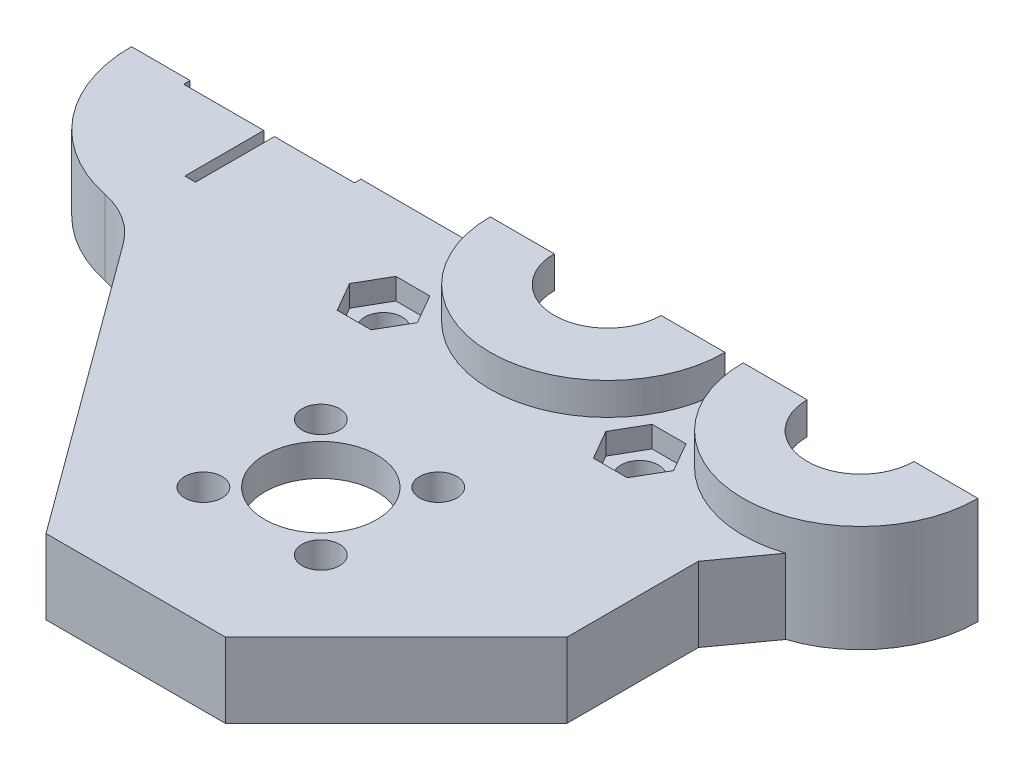
from build123d import *

# Parameters (mm, degrees)
SKETCH3_R               = 8
SKETCH3_W               = 54.803
SKETCH3_H               = 30
SKETCH3_R_2             = 5.25
BOSS_EXTRUDE1_DEPTH     = 7
CUT_EXTRUDE3_DEPTH      = 63.702230973
CUT_EXTRUDE3_DEPTH_BACK = 63.702230973
SKETCH4_R               = 1.75
CHAMFER1_SIZE           = 2.5
CUT_EXTRUDE5_DEPTH      = 63.702230973
CUT_EXTRUDE5_DEPTH_BACK = 63.702230973
SKETCH9_R               = 1.75
CUT_EXTRUDE6_START      = -2
SKETCH10_R              = 1.75
CUT_EXTRUDE6_DEPTH      = 2
CHAMFER3_SIZE2          = 22
CHAMFER3_SIZE           = 30
CHAMFER4_SIZE           = 16
FILLET1_DEPTH           = 7
BOSS_EXTRUDE6_START     = -5
SKETCH15_R              = 10.5
BOSS_EXTRUDE6_DEPTH     = 5
CUT_EXTRUDE7_DEPTH      = 63.702230973
CUT_EXTRUDE7_DEPTH_BACK = 63.702230973
SKETCH16_W              = 93.911326915
SKETCH16_H              = 20.32689663
SKETCH17_R              = 11.5
SKETCH17_R_2            = 5.25
CUT_EXTRUDE8_DEPTH      = 4
BOSS_EXTRUDE7_DEPTH     = 3


with BuildPart() as part:
    # Sketch3 → Boss-Extrude1 (new body)
    # profile 1 of 10: a face of its own
    with BuildSketch(Plane(origin=(0, 0, 0), x_dir=(1, 0, 0), z_dir=(0, 1, 0))):
        with BuildLine():
            ThreePointArc((-17.613, 0), (-21.567058454, 9.545941546), (-31.113, 13.5))
            Line((-31.113, 13.5), (-31.113, 10.5))
            ThreePointArc((-31.113, 10.5), (-23.688378798, 7.424621202), (-20.613, 0))
            ThreePointArc((-20.613, 0), (-23.688378798, -7.424621202), (-31.113, -10.5))
            Line((-31.113, -10.5), (-31.113, -13.5))
            ThreePointArc((-31.113, -13.5), (-21.567058454, -9.545941546), (-17.613, 0))
        make_face()
    # profile 2 of 10: a face of its own
    with BuildSketch(Plane(origin=(0, 0, 0), x_dir=(1, 0, 0), z_dir=(0, 1, 0))):
        with BuildLine():
            Line((-31.113, 10.5), (-31.113, 13.5))
            ThreePointArc((-31.113, 13.5), (-44.613, 0), (-31.113, -13.5))
            Line((-31.113, -13.5), (-31.113, -10.5))
            ThreePointArc((-31.113, -10.5), (-41.613, 0), (-31.113, 10.5))
        make_face()
    # profile 3 of 10: a face of its own
    with BuildSketch(Plane(origin=(0, 0, 0), x_dir=(1, 0, 0), z_dir=(0, 1, 0))):
        with BuildLine():
            Line((23.69, 13.5), (-31.113, 13.5))
            ThreePointArc((-31.113, 13.5), (-21.567058454, 9.545941546), (-17.613, 0))
            ThreePointArc((-17.613, 0), (-21.567058454, -9.545941546), (-31.113, -13.5))
            Line((-31.113, -13.5), (23.69, -13.5))
            Line((23.69, -13.5), (23.69, -11))
            ThreePointArc((23.69, -11), (12.69, 0), (23.69, 11))
            Line((23.69, 11), (23.69, 13.5))
        make_face()
        with Locations(Location((0, 0, 0), (0, 0, 270))):
            Circle(SKETCH3_R, mode=Mode.SUBTRACT)
    # profile 4 of 10: a face of its own
    with BuildSketch(Plane(origin=(0, 0, 0), x_dir=(1, 0, 0), z_dir=(0, 1, 0))):
        with BuildLine():
            ThreePointArc((-17.613, 0), (-21.567058454, 9.545941546), (-31.113, 13.5))
            Line((-31.113, 13.5), (-31.113, 10.5))
            ThreePointArc((-31.113, 10.5), (-23.688378798, 7.424621202), (-20.613, 0))
            ThreePointArc((-20.613, 0), (-23.688378798, -7.424621202), (-31.113, -10.5))
            Line((-31.113, -10.5), (-31.113, -13.5))
            ThreePointArc((-31.113, -13.5), (-21.567058454, -9.545941546), (-17.613, 0))
        make_face()
    # profile 5 of 10: a face of its own
    with BuildSketch(Plane(origin=(0, 0, 0), x_dir=(1, 0, 0), z_dir=(0, 1, 0))):
        with BuildLine():
            Line((-31.113, 10.5), (-31.113, 13.5))
            ThreePointArc((-31.113, 13.5), (-44.613, 0), (-31.113, -13.5))
            Line((-31.113, -13.5), (-31.113, -10.5))
            ThreePointArc((-31.113, -10.5), (-41.613, 0), (-31.113, 10.5))
        make_face()
    # profile 6 of 10: a face of its own
    with BuildSketch(Plane(origin=(0, 0, 0), x_dir=(1, 0, 0), z_dir=(0, 1, 0))):
        with BuildLine():
            ThreePointArc((34.69, 0), (31.468174593, 7.778174593), (23.69, 11))
            Line((23.69, 11), (23.69, 8))
            ThreePointArc((23.69, 8), (29.346854249, 5.656854249), (31.69, 0))
            ThreePointArc((31.69, 0), (29.346854249, -5.656854249), (23.69, -8))
            Line((23.69, -8), (23.69, -11))
            ThreePointArc((23.69, -11), (31.468174593, -7.778174593), (34.69, 0))
        make_face()
    # profile 7 of 10: a face of its own
    with BuildSketch(Plane(origin=(0, 0, 0), x_dir=(1, 0, 0), z_dir=(0, 1, 0))):
        with BuildLine():
            Line((23.69, 8), (23.69, 11))
            ThreePointArc((23.69, 11), (12.69, 0), (23.69, -11))
            Line((23.69, -11), (23.69, -8))
            ThreePointArc((23.69, -8), (15.69, 0), (23.69, 8))
        make_face()
    # profile 8 of 10: a face of its own
    with BuildSketch(Plane(origin=(0, 0, 0), x_dir=(1, 0, 0), z_dir=(0, 1, 0))):
        with Locations((-3.7115, -28.5)):
            Rectangle(SKETCH3_W, SKETCH3_H)
        with Locations(Location((0, -26.87, 0), (0, 0, 270))):
            Circle(SKETCH3_R_2, mode=Mode.SUBTRACT)
    # profile 9 of 10: a face of its own
    with BuildSketch(Plane(origin=(0, 0, 0), x_dir=(1, 0, 0), z_dir=(0, 1, 0))):
        with BuildLine():
            ThreePointArc((34.69, 0), (31.468174593, 7.778174593), (23.69, 11))
            Line((23.69, 11), (23.69, 8))
            ThreePointArc((23.69, 8), (29.346854249, 5.656854249), (31.69, 0))
            ThreePointArc((31.69, 0), (29.346854249, -5.656854249), (23.69, -8))
            Line((23.69, -8), (23.69, -11))
            ThreePointArc((23.69, -11), (31.468174593, -7.778174593), (34.69, 0))
        make_face()
    # profile 10 of 10: a face of its own
    with BuildSketch(Plane(origin=(0, 0, 0), x_dir=(1, 0, 0), z_dir=(0, 1, 0))):
        with BuildLine():
            Line((23.69, 8), (23.69, 11))
            ThreePointArc((23.69, 11), (12.69, 0), (23.69, -11))
            Line((23.69, -11), (23.69, -8))
            ThreePointArc((23.69, -8), (15.69, 0), (23.69, 8))
        make_face()
    extrude(amount=BOSS_EXTRUDE1_DEPTH)

    # Sketch4 → Cut-Extrude3 (cut, two sides: drawn at the far end of the back side and taken through both)
    with BuildSketch(Plane(origin=(0, 0, 0), x_dir=(1, 0, 0), z_dir=(0, 1, 0)).offset(-CUT_EXTRUDE3_DEPTH_BACK)):
        with Locations(Location((5.5, -21.37, 0), (0, 0, 270))):
            Circle(SKETCH4_R)
        with Locations(Location((5.5, -32.37, 0), (0, 0, 270))):
            Circle(SKETCH4_R)
        with Locations(Location((-5.5, -32.37, 0), (0, 0, 270))):
            Circle(SKETCH4_R)
        with Locations(Location((-5.5, -21.37, 0), (0, 0, 270))):
            Circle(SKETCH4_R)
    extrude(amount=CUT_EXTRUDE3_DEPTH + CUT_EXTRUDE3_DEPTH_BACK, mode=Mode.SUBTRACT)

    # Chamfer1
    # the kernel refuses this chamfer: 2.5 mm, written as the material it adds along each edge
    with BuildSketch(Plane(origin=(23.69, 0, -11), x_dir=(0, 0, -1), z_dir=(0, 1, 0))) as chamfer1_piece_1_section:
        with BuildLine():
            Line((CHAMFER1_SIZE, 0), (-0.385093792, -2.885093792))
            ThreePointArc((-0.385093792, -2.885093792), (-0.102088007, -1.495163601), (0, 0))
            Line((0, 0), (CHAMFER1_SIZE, 0))
        make_face()
    chamfer1_piece_1 = extrude(amount=7, mode=Mode.PRIVATE)
    chamfer1_piece_1 = split(chamfer1_piece_1, bisect_by=Plane(origin=(23.69, 0, -13.5), z_dir=(0, 0, 1)), keep=Keep.TOP, mode=Mode.PRIVATE)
    add(chamfer1_piece_1)

    # Sketch9 → Cut-Extrude5 (cut, two sides: drawn at the far end of the back side and taken through both)
    with BuildSketch(Plane(origin=(0, 0, 0), x_dir=(1, 0, 0), z_dir=(0, 1, 0)).offset(-CUT_EXTRUDE5_DEPTH_BACK)):
        with Locations(Location((12, 9, 0), (0, 0, 270))):
            Circle(SKETCH9_R)
        with Locations(Location((12, -9, 0), (0, 0, 270))):
            Circle(SKETCH9_R)
        with Locations(Location((-12, -9, 0), (0, 0, 270))):
            Circle(SKETCH9_R)
        with Locations(Location((-12, 9, 0), (0, 0, 270))):
            Circle(SKETCH9_R)
    extrude(amount=CUT_EXTRUDE5_DEPTH + CUT_EXTRUDE5_DEPTH_BACK, mode=Mode.SUBTRACT)

    # Sketch10 → Cut-Extrude6 (cut)
    # profile 1 of 4: a face of its own
    with BuildSketch(Plane(origin=(0, 7, 0), x_dir=(1, 0, 0), z_dir=(0, 1, 0)).offset(CUT_EXTRUDE6_START)):
        Polygon((-15.175426481, -9), (-13.58771324, -11.75), (-10.41228676, -11.75), (-8.824573519, -9), (-10.41228676, -6.25), (-13.58771324, -6.25), align=None)
        with Locations(Location((-12, -9, 0), (0, 0, 270))):
            Circle(SKETCH10_R, mode=Mode.SUBTRACT)
    # profile 2 of 4: a face of its own
    with BuildSketch(Plane(origin=(0, 7, 0), x_dir=(1, 0, 0), z_dir=(0, 1, 0)).offset(CUT_EXTRUDE6_START)):
        Polygon((-15.175426481, 9), (-13.58771324, 6.25), (-10.41228676, 6.25), (-8.824573519, 9), (-10.41228676, 11.75), (-13.58771324, 11.75), align=None)
        with Locations(Location((-12, 9, 0), (0, 0, 270))):
            Circle(SKETCH10_R, mode=Mode.SUBTRACT)
    # profile 3 of 4: a face of its own
    with BuildSketch(Plane(origin=(0, 7, 0), x_dir=(1, 0, 0), z_dir=(0, 1, 0)).offset(CUT_EXTRUDE6_START)):
        Polygon((15.175426481, 9), (13.58771324, 11.75), (10.41228676, 11.75), (8.824573519, 9), (10.41228676, 6.25), (13.58771324, 6.25), align=None)
        with Locations(Location((12, 9, 0), (0, 0, 270))):
            Circle(SKETCH10_R, mode=Mode.SUBTRACT)
    # profile 4 of 4: a face of its own
    with BuildSketch(Plane(origin=(0, 7, 0), x_dir=(1, 0, 0), z_dir=(0, 1, 0)).offset(CUT_EXTRUDE6_START)):
        Polygon((15.175426481, -9), (13.58771324, -6.25), (10.41228676, -6.25), (8.824573519, -9), (10.41228676, -11.75), (13.58771324, -11.75), align=None)
        with Locations(Location((12, -9, 0), (0, 0, 270))):
            Circle(SKETCH10_R, mode=Mode.SUBTRACT)
    extrude(amount=CUT_EXTRUDE6_DEPTH, mode=Mode.SUBTRACT)

    # Chamfer2
    # the kernel refuses this chamfer: 5 mm, written as the material it adds along each edge
    with BuildSketch(Plane(origin=(23.69, 0, 11), x_dir=(0.9874000606639179, 0, -0.15824386307497393), z_dir=(0, 1, 0))) as chamfer2_piece_1:
        with BuildLine():
            Line((3.622786344, 0.141421356), (-0.805837357, -4.287202344))
            Line((-0.805837357, -4.287202344), (-0.904577363, -4.271377958))
            ThreePointArc((-0.904577363, -4.271377958), (-0.443767224, -2.137054655), (-0.098740006, 0.015824386))
            Line((-0.098740006, 0.015824386), (0.015824386, 0.098740006))
            ThreePointArc((0.015824386, 0.098740006), (1.81210794, -0.038365312), (3.606961958, 0.240161362))
            Line((3.606961958, 0.240161362), (3.622786344, 0.141421356))
        make_face()
    extrude(amount=7)

    # Chamfer3
    chamfer3_edges = [part.edges().sort_by_distance(p)[0] for p in [
        (-31.113, 3.5, 43.5),
    ]]
    chamfer3_side = [part.faces().sort_by_distance(p)[0] for p in [
        (-31.113, 3.5, 43.06),
    ]]
    chamfer(chamfer3_edges, length=CHAMFER3_SIZE - 0.0001, length2=CHAMFER3_SIZE2 - 0.0001, reference=chamfer3_side[0])  # a hair under: the kernel refuses the full size

    # Chamfer4
    chamfer4_edges = [part.edges().sort_by_distance(p)[0] for p in [
        (23.69, 3.5, 43.5),
    ]]
    chamfer(chamfer4_edges, length=CHAMFER4_SIZE)

    # Fillet1: read off the stored shape, not the designer's step
    # Fillet1 outline → Fillet1 (add)
    with BuildSketch(Plane(origin=(0, 0, 0), x_dir=(1, 0, 0), z_dir=(0, 1, 0))):
        with BuildLine():
            ThreePointArc((-31.113, -13.5), (-32.497095712, -13.428859932), (-33.866604066, -13.21618949))
            ThreePointArc((-33.866604066, -13.21618949), (-31.169668779, -14.320275511), (-29.047129471, -16.317096176))
            Line((-29.047129471, -16.317096176), (-31.113, -13.5))
        make_face()
    extrude(amount=FILLET1_DEPTH)

    # Sketch15 → Boss-Extrude6 (add)
    with BuildSketch(Plane(origin=(0, 7, 0), x_dir=(1, 0, 0), z_dir=(0, 1, 0)).offset(BOSS_EXTRUDE6_START)):
        with Locations(Location((-31.113, 0, 0), (0, 0, 270))):
            Circle(SKETCH15_R)
        Polygon((-31.613, 0.6), (-31.613, 8), (-30.613, 8), (-30.613, 0.6), (-23.113, 0.6), (-23.113, -0.6), (-30.613, -0.6), (-30.613, -8), (-31.613, -8), (-31.613, -0.6), (-39.113, -0.6), (-39.113, 0.6), align=None, mode=Mode.SUBTRACT)
    extrude(amount=BOSS_EXTRUDE6_DEPTH)

    # Sketch16 → Cut-Extrude7 (cut, two sides: drawn at the far end of the back side and taken through both)
    with BuildSketch(Plane(origin=(0, 0, 0), x_dir=(1, 0, 0), z_dir=(0, 1, 0)).offset(-CUT_EXTRUDE7_DEPTH_BACK)):
        with Locations((-7.189027051, 10.163448315)):
            Rectangle(SKETCH16_W, SKETCH16_H)
    extrude(amount=CUT_EXTRUDE7_DEPTH + CUT_EXTRUDE7_DEPTH_BACK, mode=Mode.SUBTRACT)

    # Sketch17 → Cut-Extrude8 (cut)
    with BuildSketch(Plane(origin=(0, 0, 0), x_dir=(1, 0, 0), z_dir=(0, 1, 0))):
        with Locations(Location((0, -26.87, 0), (0, 0, 270))):
            Circle(SKETCH17_R)
        with Locations(Location((0, -26.87, 0), (0, 0, 270))):
            Circle(SKETCH17_R_2, mode=Mode.SUBTRACT)
    extrude(amount=CUT_EXTRUDE8_DEPTH, mode=Mode.SUBTRACT)

    # Sketch18 → Boss-Extrude7 (add)
    with BuildSketch(Plane(origin=(0, 7, 0), x_dir=(1, 0, 0), z_dir=(0, 1, 0))):
        with BuildLine():
            ThreePointArc((-8, 0), (0, -8), (8, 0))
            Line((8, 0), (5, 0))
            ThreePointArc((5, 0), (0, -5), (-5, 0))
            Line((-5, 0), (-8, 0))
        make_face()
        with BuildLine():
            ThreePointArc((-11, 0), (0, -11), (11, 0))
            Line((11, 0), (8, 0))
            ThreePointArc((8, 0), (0, -8), (-8, 0))
            Line((-8, 0), (-11, 0))
        make_face()
        with BuildLine():
            ThreePointArc((27.1275, -10.449095356), (32.60101846, -6.44932167), (34.69, 0))
            Line((34.69, 0), (31.69, 0))
            ThreePointArc((31.69, 0), (23.69, -8), (15.69, 0))
            Line((15.69, 0), (12.69, 0))
            ThreePointArc((12.69, 0), (17.24067833, -8.91101846), (27.1275, -10.449095356))
        make_face()
        with BuildLine():
            ThreePointArc((15.69, 0), (23.69, -8), (31.69, 0))
            Line((31.69, 0), (28.69, 0))
            ThreePointArc((28.69, 0), (23.69, -5), (18.69, 0))
            Line((18.69, 0), (15.69, 0))
        make_face()
    extrude(amount=BOSS_EXTRUDE7_DEPTH)


solid = part.part
